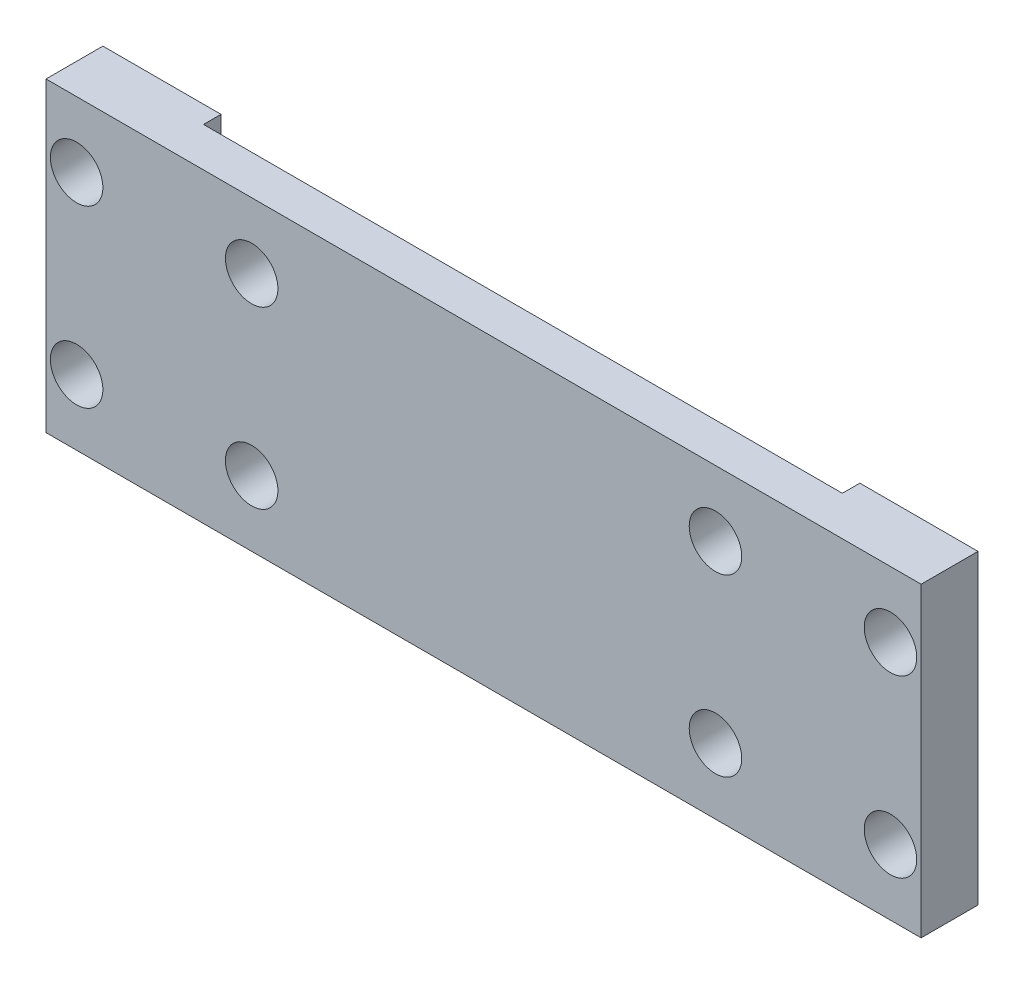
from build123d import *

# Parameters (mm, degrees)
ESQUISSE1_W          = 13.5
ESQUISSE1_H          = 35
ESQUISSE1_R          = 1.75
BOSS_EXTRU_1_DEPTH   = 2
BOSS_EXTRU_1_2_DEPTH = 2
ESQUISSE2_W          = 100
ESQUISSE2_H          = 35
ESQUISSE2_R          = 3
BOSS_EXTRU_2_DEPTH   = 4.5


with BuildPart() as part:
    # Esquisse1 → Boss.-Extru.1 (new body)
    with BuildSketch(Plane.XY):
        with Locations((-43.25, -17.5)):
            Rectangle(ESQUISSE1_W, ESQUISSE1_H)
        with Locations((-46.5, -7.5)):
            Circle(ESQUISSE1_R, mode=Mode.SUBTRACT)
        with Locations((-46.5, -27.5)):
            Circle(ESQUISSE1_R, mode=Mode.SUBTRACT)
    extrude(amount=BOSS_EXTRU_1_DEPTH)



with BuildPart() as body_2:
    # Esquisse1 → Boss.-Extru.1 2 (new body)
    with BuildSketch(Plane.XY):
        with Locations((43.25, -17.5)):
            Rectangle(ESQUISSE1_W, ESQUISSE1_H)
        with Locations((46.5, -27.5)):
            Circle(ESQUISSE1_R, mode=Mode.SUBTRACT)
        with Locations((46.5, -7.5)):
            Circle(ESQUISSE1_R, mode=Mode.SUBTRACT)
    extrude(amount=BOSS_EXTRU_1_2_DEPTH)


with BuildPart() as part_1:
    add(part.part)

    add(body_2.part)  # Boss.-Extru.2 merges body 2
    # Esquisse2 → Boss.-Extru.2 (add)
    with BuildSketch(Plane.XY.offset(2)):
        with Locations((0, -17.5)):
            Rectangle(ESQUISSE2_W, ESQUISSE2_H)
        with Locations((-46.5, -7.5)):
            Circle(ESQUISSE2_R, mode=Mode.SUBTRACT)
        with Locations((-46.5, -27.5)):
            Circle(ESQUISSE2_R, mode=Mode.SUBTRACT)
        with Locations((46.5, -7.5)):
            Circle(ESQUISSE2_R, mode=Mode.SUBTRACT)
        with Locations((46.5, -27.5)):
            Circle(ESQUISSE2_R, mode=Mode.SUBTRACT)
        with Locations((-26.5, -7.5)):
            Circle(ESQUISSE2_R, mode=Mode.SUBTRACT)
        with Locations((-26.5, -27.5)):
            Circle(ESQUISSE2_R, mode=Mode.SUBTRACT)
        with Locations((26.5, -27.5)):
            Circle(ESQUISSE2_R, mode=Mode.SUBTRACT)
        with Locations((26.5, -7.5)):
            Circle(ESQUISSE2_R, mode=Mode.SUBTRACT)
    extrude(amount=BOSS_EXTRU_2_DEPTH)


solid = part_1.part
